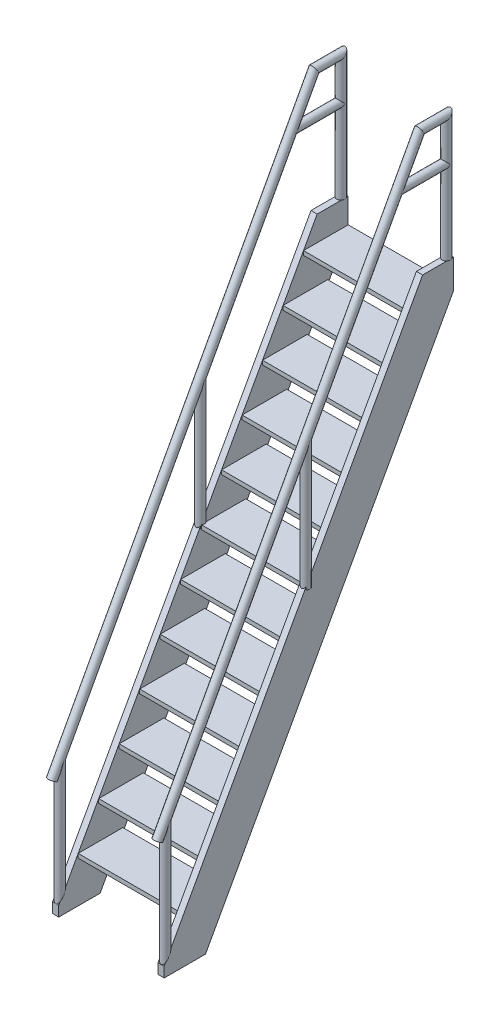
from build123d import *

# Parameters (mm, degrees)
BOSS_EXTRUDE2_DEPTH                  = 38.1
SKETCH4_W                            = 274.389908257
SKETCH4_H                            = 25.4
SKETCH4_W_2                          = 274.389908256
BOSS_EXTRUDE3_DEPTH                  = 304.8
BOSS_EXTRUDE4_REACH                  = 3225.624
SKETCH5_R                            = 25.4
BOSS_EXTRUDE4_DIRECTION_2_DEPTH      = 544.57854
SKETCH6_R                            = 25.4
BOSS_EXTRUDE5_DEPTH                  = 762
BOSS_EXTRUDE6_REACH                  = 3447.353
BOSS_EXTRUDE6_END_RADIUS             = 25.4
SKETCH7_R                            = 25.4
BOSS_EXTRUDE7_START                  = -165.1
SKETCH7_2_R                          = 25.4
BOSS_EXTRUDE7_DEPTH                  = 165.1
SKETCH9_R                            = 25.4
BOSS_EXTRUDE8_DEPTH                  = 3382.01
BOSS_EXTRUDE8_DIRECTION_2_REACH      = 4048.883
BOSS_EXTRUDE8_DIRECTION_2_END_RADIUS = 25.4
BOSS_EXTRUDE14_REACH                 = 2643.069
SKETCH14_R                           = 25.4
BOSS_EXTRUDE14_DIRECTION_2_DEPTH     = 251.714
BOSS_EXTRUDE15_REACH                 = 3470.665
BOSS_EXTRUDE15_END_RADIUS            = 25.4
SKETCH15_R                           = 25.4


with BuildPart() as part:
    # Sketch3 → Boss-Extrude2 (new body)
    with BuildSketch(Plane(origin=(0, 0, 0), x_dir=(0, 0, -1), z_dir=(1, 0, 0))):
        Polygon((0, 0), (-190.5, 0), (-1778, -2883.958333333), (-1778, -2946.4), (-1524, -2946.4), (0, -177.8), align=None)
    extrude(amount=BOSS_EXTRUDE2_DEPTH)

    # Sketch4 → Boss-Extrude3 (add)
    with BuildSketch(Plane(origin=(38.1, 0, 0), x_dir=(0, 0, -1), z_dir=(1, 0, 0))):
        with Locations((-137.194954129, -165.1)):
            Rectangle(SKETCH4_W, SKETCH4_H)
        with Locations((-263.029816514, -393.7)):
            Rectangle(SKETCH4_W, SKETCH4_H)
        with Locations((-388.8646789, -622.3)):
            Rectangle(SKETCH4_W, SKETCH4_H)
        with Locations((-514.699541285, -850.9)):
            Rectangle(SKETCH4_W, SKETCH4_H)
        with Locations((-640.53440367, -1079.5)):
            Rectangle(SKETCH4_W, SKETCH4_H)
        with Locations((-766.369266055, -1308.1)):
            Rectangle(SKETCH4_W_2, SKETCH4_H)
        with Locations((-892.20412844, -1536.7)):
            Rectangle(SKETCH4_W, SKETCH4_H)
        with Locations((-1018.038990826, -1765.3)):
            Rectangle(SKETCH4_W, SKETCH4_H)
        with Locations((-1143.873853211, -1993.9)):
            Rectangle(SKETCH4_W_2, SKETCH4_H)
        with Locations((-1269.708715597, -2222.5)):
            Rectangle(SKETCH4_W, SKETCH4_H)
        with Locations((-1395.543577982, -2451.1)):
            Rectangle(SKETCH4_W, SKETCH4_H)
        with Locations((-1521.378440367, -2679.7)):
            Rectangle(SKETCH4_W_2, SKETCH4_H)
    extrude(amount=BOSS_EXTRUDE3_DEPTH)

    # Boss-Extrude4: up to this plane
    boss_extrude4_end = Plane(origin=(38.1, 0, 190.5), z_dir=(0, -0.4822272466064925, -0.8760461646684615))
    # Sketch5 → Boss-Extrude4 (add, up to the surface)
    with BuildSketch(Plane(origin=(0, -2667, 0), x_dir=(1, 0, 0), z_dir=(0, 1, 0)), mode=Mode.PRIVATE) as boss_extrude4_sk1:
        with Locations((19.05, -1752.6)):
            Circle(SKETCH5_R)
    boss_extrude4_tool1 = split(extrude(boss_extrude4_sk1.sketch, amount=-BOSS_EXTRUDE4_REACH, mode=Mode.PRIVATE), bisect_by=boss_extrude4_end, keep=Keep.BOTH, mode=Mode.PRIVATE)
    add(boss_extrude4_tool1.solids().sort_by_distance((19.05, -2667, 1752.6))[0])

    # Sketch5 → Boss-Extrude4 direction 2 (add)
    with BuildSketch(Plane(origin=(0, -2667, 0), x_dir=(1, 0, 0), z_dir=(0, 1, 0))):
        with Locations((19.05, -1752.6)):
            Circle(SKETCH5_R)
    extrude(amount=BOSS_EXTRUDE4_DIRECTION_2_DEPTH)

    # Sketch6 → Boss-Extrude5 (add)
    with BuildSketch(Plane(origin=(0, 0, 0), x_dir=(1, 0, 0), z_dir=(0, 1, 0))):
        with Locations((19.05, -25.4)):
            Circle(SKETCH6_R)
    extrude(amount=BOSS_EXTRUDE5_DEPTH)

    # Boss-Extrude6: up to this cylinder (the profile starts inside it)
    boss_extrude6_end = Plane(origin=(19.05, 762, 25.4), z_dir=(0, -1, 0)) * Cylinder(BOSS_EXTRUDE6_END_RADIUS, 6946.506, mode=Mode.PRIVATE)
    # Sketch7 → Boss-Extrude6 (add, up to the surface)
    with BuildSketch(Plane(origin=(0, 0, 25.4), x_dir=(-1, 0, 0), z_dir=(0, 0, -1)), mode=Mode.PRIVATE) as boss_extrude6_sk1:
        with Locations((-19.05, 762)):
            Circle(SKETCH7_R)
    boss_extrude6_tool1 = extrude(boss_extrude6_sk1.sketch, amount=BOSS_EXTRUDE6_REACH, mode=Mode.PRIVATE) & boss_extrude6_end
    add(boss_extrude6_tool1.solids().sort_by_distance((19.05, 762, 25.4))[0])

    # Sketch7<2> → Boss-Extrude7 (add)
    with BuildSketch(Plane(origin=(0, 0, 25.4), x_dir=(-1, 0, 0), z_dir=(0, 0, -1)).offset(BOSS_EXTRUDE7_START)):
        with Locations((-19.05, 762)):
            Circle(SKETCH7_2_R)
    extrude(amount=BOSS_EXTRUDE7_DEPTH)


with BuildPart() as boss_extrude8_tool:
    # Sketch9 → Boss-Extrude8 (new body)
    with BuildSketch(Plane(origin=(19.05, 762, 190.5), x_dir=(1, 0, 0), z_dir=(0, -0.8793296212246964, 0.47621362563122044))):
        Circle(SKETCH9_R)
    extrude(amount=BOSS_EXTRUDE8_DEPTH)


with BuildPart() as part_1:
    add(part.part)


with BuildPart() as part_2:
    # Boss-Extrude8: joined with boss_extrude8_tool
    add(part_1.part.fuse(boss_extrude8_tool.part, tol=0.00001))

    # Boss-Extrude8 direction 2: up to this cylinder (the profile starts inside it)
    boss_extrude8_direction_2_end = Plane(origin=(19.05, 762, 190.5), z_dir=(0, 0, 1)) * Cylinder(BOSS_EXTRUDE8_DIRECTION_2_END_RADIUS, 8149.566, mode=Mode.PRIVATE)
    # Sketch9 → Boss-Extrude8 direction 2 (add, up to the surface)
    with BuildSketch(Plane(origin=(19.05, 762, 190.5), x_dir=(1, 0, 0), z_dir=(0, -0.8793296212246964, 0.47621362563122044)), mode=Mode.PRIVATE) as boss_extrude8_direction_2_sk1:
        Circle(SKETCH9_R)
    boss_extrude8_direction_2_tool1 = extrude(boss_extrude8_direction_2_sk1.sketch, amount=-BOSS_EXTRUDE8_DIRECTION_2_REACH, mode=Mode.PRIVATE) & boss_extrude8_direction_2_end
    add(boss_extrude8_direction_2_tool1.solids().sort_by_distance((19.05, 762, 190.5))[0])

    # Sketch14 → Boss-Extrude14 (add, up to next)
    with BuildSketch(Plane(origin=(0, -1066.8, 0), x_dir=(1, 0, 0), z_dir=(0, 1, 0)), mode=Mode.PRIVATE) as boss_extrude14_sk1:
        with Locations((19.05, -889)):
            Circle(SKETCH14_R)
    boss_extrude14_tool1 = extrude(boss_extrude14_sk1.sketch, amount=BOSS_EXTRUDE14_REACH, mode=Mode.PRIVATE) - part_2.part
    add(boss_extrude14_tool1.solids().sort_by_distance((19.05, -1066.8, 889))[0])

    # Sketch14 → Boss-Extrude14 direction 2 (add)
    with BuildSketch(Plane(origin=(0, -1066.8, 0), x_dir=(1, 0, 0), z_dir=(0, 1, 0))):
        with Locations((19.05, -889)):
            Circle(SKETCH14_R)
    extrude(amount=-BOSS_EXTRUDE14_DIRECTION_2_DEPTH)

    # Boss-Extrude15: up to this cylinder (the profile starts outside it)
    boss_extrude15_end = Plane(origin=(19.05, 634.737390116, 259.420899964), z_dir=(0, -0.8793296212246964, 0.4762136256312204)) * Cylinder(BOSS_EXTRUDE15_END_RADIUS, 6993.13, mode=Mode.PRIVATE)
    # Sketch15 → Boss-Extrude15 (add, up to the surface)
    with BuildSketch(Plane(origin=(0, 0, 25.4), x_dir=(-1, 0, 0), z_dir=(0, 0, -1)), mode=Mode.PRIVATE) as boss_extrude15_sk1:
        with Locations((-19.05, 508)):
            Circle(SKETCH15_R)
    boss_extrude15_tool1 = extrude(boss_extrude15_sk1.sketch, amount=-BOSS_EXTRUDE15_REACH, mode=Mode.PRIVATE) - boss_extrude15_end
    add(boss_extrude15_tool1.solids().sort_by_distance((19.05, 508, 25.4))[0])

    # Mirror5: part across plane


with BuildPart() as part_3:
    add(part_2.part)
    add(part_2.part.mirror(Plane(origin=(342.9, 0, 0), x_dir=(0, 0, 1), z_dir=(1, 0, 0))))


solid = part_3.part
